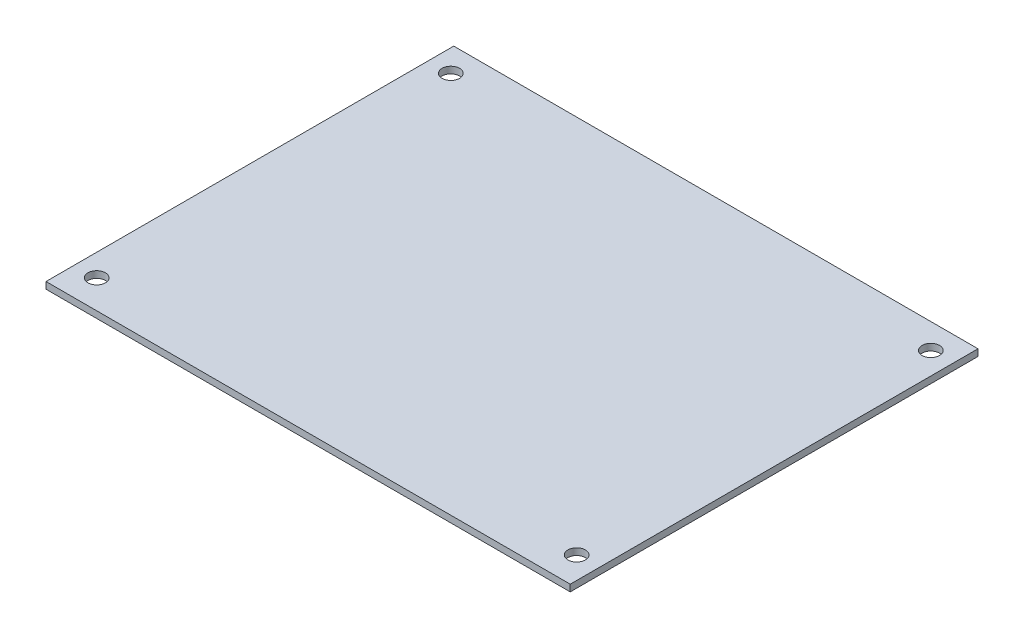
from build123d import *

# Parameters (mm, degrees)
SKETCH_1_W          = 90
SKETCH_1_H          = 70
EXTRUDE_1_DEPTH     = 1.15
SKETCH_2_R          = 1.5
CUT_EXTRUDE_1_DEPTH = 58.020369168


with BuildPart() as part:
    # 草圖1 → 填料-伸長1 (new body)
    with BuildSketch(Plane(origin=(0, 0, 0), x_dir=(1, 0, 0), z_dir=(0, 1, 0))):
        Rectangle(SKETCH_1_W, SKETCH_1_H)
    extrude(amount=EXTRUDE_1_DEPTH)

    # 草圖2 → 除料-伸長1 (cut, through all)
    with BuildSketch(Plane(origin=(0, 1.15, 0), x_dir=(1, 0, 0), z_dir=(0, 1, 0))):
        with Locations((41.2, 30.7)):
            Circle(SKETCH_2_R)
        with Locations((41.2, -30.1)):
            Circle(SKETCH_2_R)
        with Locations((-41.2, -30.1)):
            Circle(SKETCH_2_R)
        with Locations((-41.2, 30.7)):
            Circle(SKETCH_2_R)
    extrude(amount=-CUT_EXTRUDE_1_DEPTH, mode=Mode.SUBTRACT)


solid = part.part
